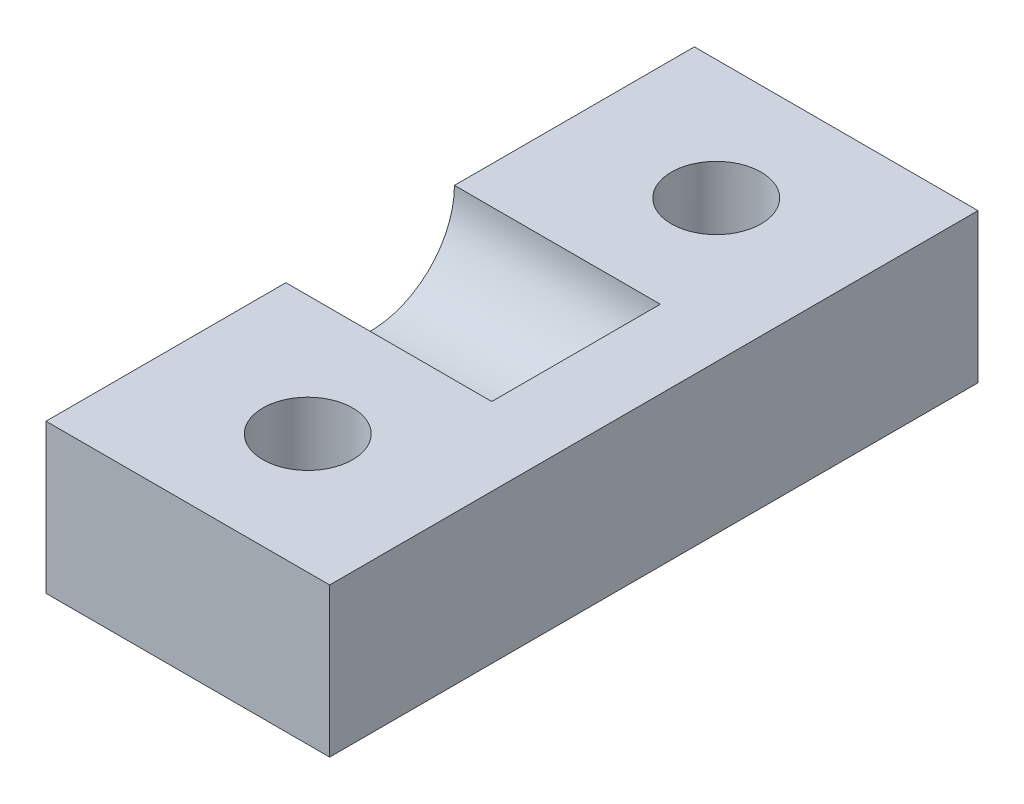
from build123d import *

# Parameters (mm, degrees)
SKETCH1_W           = 11.1125
SKETCH1_H           = 25.4
BOSS_EXTRUDE1_DEPTH = 6.35
SKETCH2_R           = 3.302
CUT_EXTRUDE1_DEPTH  = 8.0645
CUT_EXTRUDE2_REACH  = 17.247
SKETCH3_R           = 1.75895
CHAMFER1_SIZE       = 0.508


with BuildPart() as part:
    # Sketch1 → Boss-Extrude1 (new body)
    with BuildSketch(Plane(origin=(0, 0, 0), x_dir=(1, 0, 0), z_dir=(0, 1, 0))):
        Rectangle(SKETCH1_W, SKETCH1_H)
    extrude(amount=-BOSS_EXTRUDE1_DEPTH)

    # Sketch2 → Cut-Extrude1 (cut)
    with BuildSketch(Plane.ZY.offset(5.55625)):
        Circle(SKETCH2_R)
    extrude(amount=-CUT_EXTRUDE1_DEPTH, mode=Mode.SUBTRACT)

    # Sketch3 → Cut-Extrude2 (cut, up to next)
    with BuildSketch(Plane(origin=(0, 0, 0), x_dir=(1, 0, 0), z_dir=(0, 1, 0)), mode=Mode.PRIVATE) as cut_extrude2_sk1:
        with Locations((0, 8.001)):
            Circle(SKETCH3_R)
    cut_extrude2_tool1 = extrude(cut_extrude2_sk1.sketch, amount=-CUT_EXTRUDE2_REACH, mode=Mode.PRIVATE) & part.part
    # Sketch3 → Cut-Extrude2 (cut, up to next)
    with BuildSketch(Plane(origin=(0, 0, 0), x_dir=(1, 0, 0), z_dir=(0, 1, 0)), mode=Mode.PRIVATE) as cut_extrude2_sk2:
        with Locations((0, -8.001)):
            Circle(SKETCH3_R)
    cut_extrude2_tool2 = extrude(cut_extrude2_sk2.sketch, amount=-CUT_EXTRUDE2_REACH, mode=Mode.PRIVATE) & part.part
    add(cut_extrude2_tool1.solids().sort_by_distance((0, 0, -8.001))[0], mode=Mode.SUBTRACT)
    add(cut_extrude2_tool2.solids().sort_by_distance((0, 0, 8.001))[0], mode=Mode.SUBTRACT)

    # Chamfer1
    chamfer1_edges = [part.edges().sort_by_distance(p)[0] for p in [
        (0, -6.35, 12.7),
        (-5.55625, -6.35, 0),
        (0, -6.35, -12.7),
        (5.55625, -6.35, 0),
    ]]
    chamfer(chamfer1_edges, length=CHAMFER1_SIZE)


solid = part.part
